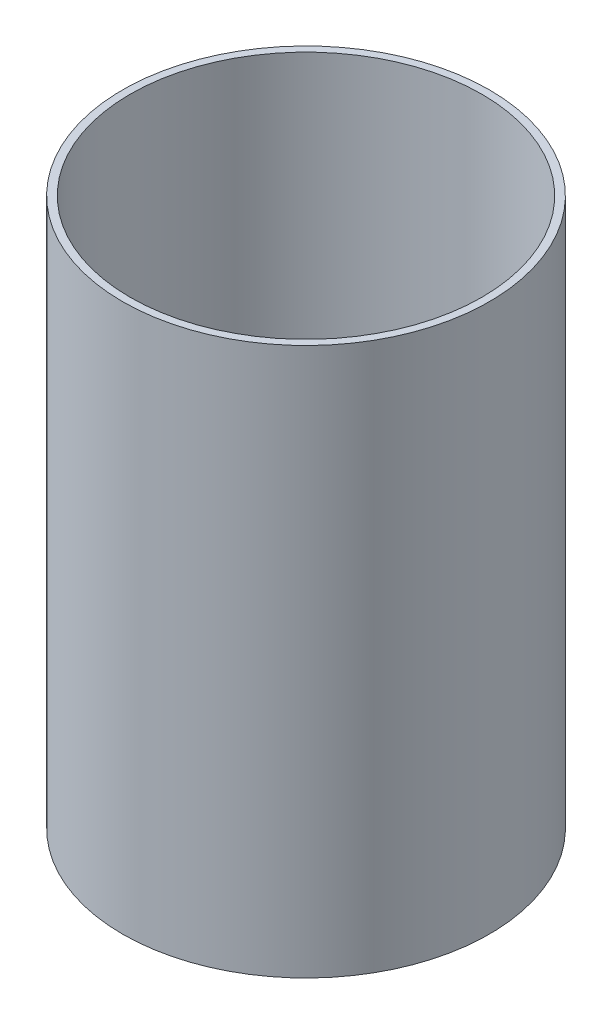
from build123d import *

# Parameters (mm, degrees)
ESQUISSE1_R        = 36.5
BOSS_EXTRU_1_DEPTH = 109
COQUE1_T           = -1.5


with BuildPart() as part:
    # Esquisse1 → Boss.-Extru.1 (new body)
    with BuildSketch(Plane(origin=(0, 0, 0), x_dir=(1, 0, 0), z_dir=(0, 1, 0))):
        Circle(ESQUISSE1_R)
    extrude(amount=BOSS_EXTRU_1_DEPTH)

    # Coque1
    coque1_openings = [part.faces().sort_by_distance(p)[0] for p in [
        (0, 109, 0),
    ]]
    offset(amount=COQUE1_T, openings=coque1_openings, kind=Kind.INTERSECTION)


solid = part.part
